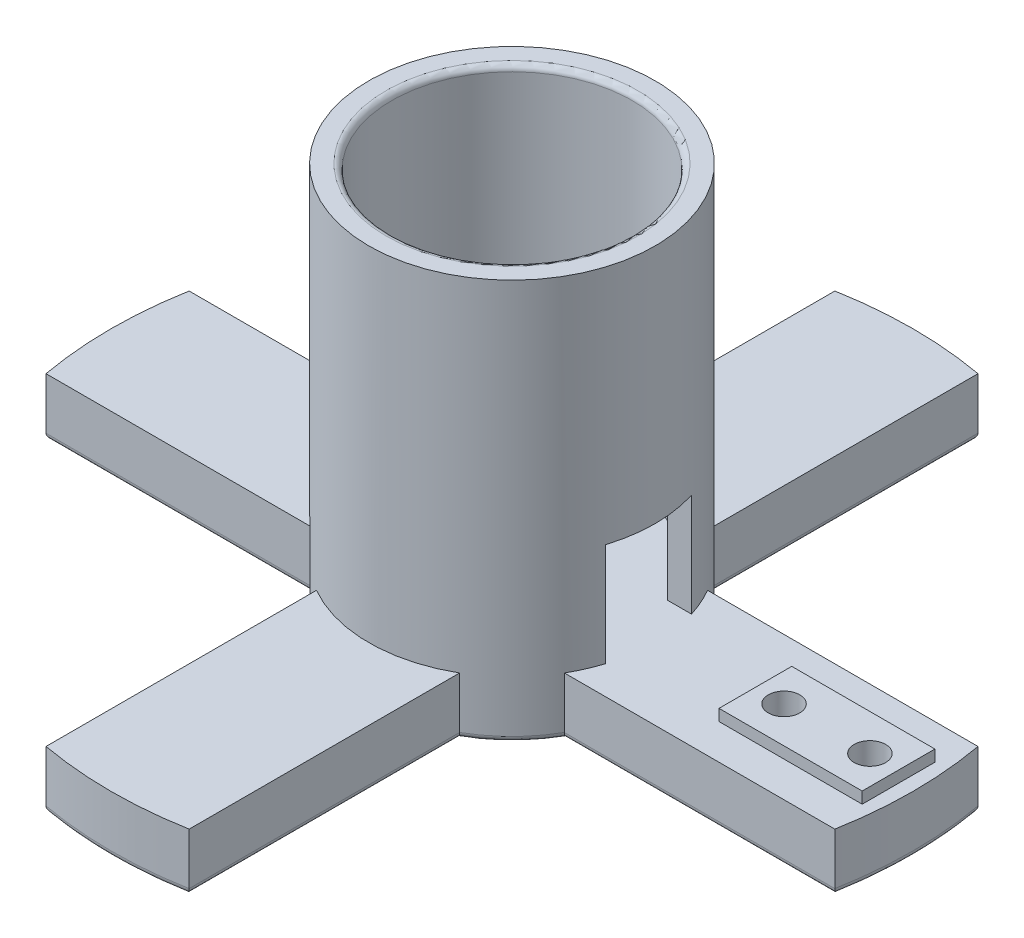
from build123d import *

# Parameters (mm, degrees)
BOSS_EXTRUDE1_DEPTH = 10
SKETCH2_R           = 25
SKETCH2_R_2         = 21
BOSS_EXTRUDE2_DEPTH = 60
SKETCH3_W           = 15
SKETCH3_H           = 18
CUT_EXTRUDE1_DEPTH  = 10
SKETCH4_W           = 25
SKETCH4_H           = 12.7
BOSS_EXTRUDE3_DEPTH = 2
SKETCH5_R           = 2.75
CUT_EXTRUDE2_DEPTH  = 115.734476074
SKETCH6_R           = 5
CUT_EXTRUDE3_DEPTH  = 6
FILLET1_R           = 1


with BuildPart() as part:
    # Sketch1 → Boss-Extrude1 (new body)
    with BuildSketch(Plane(origin=(0, 0, 0), x_dir=(1, 0, 0), z_dir=(0, 1, 0))):
        with BuildLine():
            Line((-68.87488657, 12.5), (-21.650635095, 12.5))
            ThreePointArc((-21.650635095, 12.5), (-17.67766953, 17.67766953), (-12.5, 21.650635095))
            Line((-12.5, 21.650635095), (-12.5, 68.87488657))
            ThreePointArc((-12.5, 68.87488657), (0, 70), (12.5, 68.87488657))
            Line((12.5, 68.87488657), (12.5, 21.650635095))
            ThreePointArc((12.5, 21.650635095), (17.67766953, 17.67766953), (21.650635095, 12.5))
            Line((21.650635095, 12.5), (68.87488657, 12.5))
            ThreePointArc((68.87488657, 12.5), (70, 0), (68.87488657, -12.5))
            Line((68.87488657, -12.5), (21.650635095, -12.5))
            ThreePointArc((21.650635095, -12.5), (17.67766953, -17.67766953), (12.5, -21.650635095))
            Line((12.5, -21.650635095), (12.5, -68.87488657))
            ThreePointArc((12.5, -68.87488657), (0, -70), (-12.5, -68.87488657))
            Line((-12.5, -68.87488657), (-12.5, -21.650635095))
            ThreePointArc((-12.5, -21.650635095), (-17.67766953, -17.67766953), (-21.650635095, -12.5))
            Line((-21.650635095, -12.5), (-68.87488657, -12.5))
            ThreePointArc((-68.87488657, -12.5), (-70, 0), (-68.87488657, 12.5))
        make_face()
    extrude(amount=BOSS_EXTRUDE1_DEPTH)

    # Sketch2 → Boss-Extrude2 (add)
    with BuildSketch(Plane(origin=(0, 10, 0), x_dir=(1, 0, 0), z_dir=(0, 1, 0))):
        Circle(SKETCH2_R)
        Circle(SKETCH2_R_2, mode=Mode.SUBTRACT)
    extrude(amount=BOSS_EXTRUDE2_DEPTH)

    # Sketch3 → Cut-Extrude1 (cut)
    with BuildSketch(Plane(origin=(25, 0, 0), x_dir=(0, 0, -1), z_dir=(1, 0, 0))):
        with Locations((0, 19)):
            Rectangle(SKETCH3_W, SKETCH3_H)
    extrude(amount=-CUT_EXTRUDE1_DEPTH, mode=Mode.SUBTRACT)

    # Sketch4 → Boss-Extrude3 (add)
    with BuildSketch(Plane(origin=(0, 10, 0), x_dir=(1, 0, 0), z_dir=(0, 1, 0))):
        with Locations((55, 0)):
            Rectangle(SKETCH4_W, SKETCH4_H)
    extrude(amount=BOSS_EXTRUDE3_DEPTH)

    # Sketch5 → Cut-Extrude2 (cut, through all)
    with BuildSketch(Plane(origin=(0, 12, 0), x_dir=(1, 0, 0), z_dir=(0, 1, 0))):
        with Locations((47.5, 0)):
            Circle(SKETCH5_R)
        with Locations((62.5, 0)):
            Circle(SKETCH5_R)
    extrude(amount=-CUT_EXTRUDE2_DEPTH, mode=Mode.SUBTRACT)

    # Sketch6 → Cut-Extrude3 (cut)
    with BuildSketch(Plane.XZ):
        with Locations((47.5, 0)):
            Circle(SKETCH6_R)
        with Locations((62.5, 0)):
            Circle(SKETCH6_R)
    extrude(amount=-CUT_EXTRUDE3_DEPTH, mode=Mode.SUBTRACT)

    # Fillet1
    fillet1_edges = [part.edges().sort_by_distance(p)[0] for p in [
        (-45.262760832, 0, 12.5),
        (-17.67766953, 0, 17.67766953),
        (-12.5, 0, 45.262760832),
        (0, 0, 70),
        (12.5, 0, 45.262760832),
        (17.67766953, 0, 17.67766953),
        (45.262760832, 0, 12.5),
        (70, 0, 0),
        (45.262760832, 0, -12.5),
        (17.67766953, 0, -17.67766953),
        (12.5, 0, -45.262760832),
        (0, 0, -70),
        (-12.5, 0, -45.262760832),
        (-17.67766953, 0, -17.67766953),
        (-45.262760832, 0, -12.5),
        (-70, 0, 0),
        (42.5, 0, 0),
        (57.5, 0, 0),
        (-21, 70, 0),
    ]]
    fillet(fillet1_edges, radius=FILLET1_R)


solid = part.part
